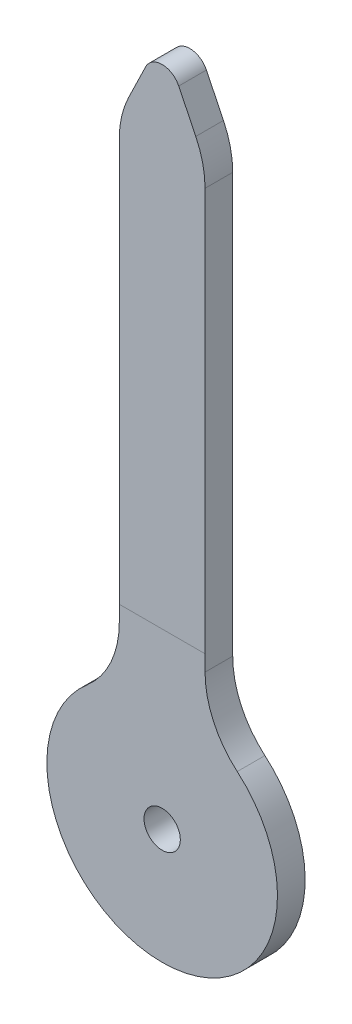
from build123d import *

# Parameters (mm, degrees)
SKETCH1_R           = 0.5
BOSS_EXTRUDE1_DEPTH = 0.762
FILLET1_R           = 2.54
FILLET2_R           = 0.507185


with BuildPart() as part:
    # Sketch1 → Boss-Extrude1 (new body)
    with BuildSketch(Plane.XY):
        with BuildLine():
            Line((-0.3175, 18.2372), (0.3175, 18.2372))
            Line((0.3175, 18.2372), (1.1811, 16.4592))
            Line((1.1811, 16.4592), (1.1811, 2.947138916))
            ThreePointArc((1.1811, 2.947138916), (0, -3.175), (-1.1811, 2.947138916))
            Line((-1.1811, 2.947138916), (-1.1811, 16.4592))
            Line((-1.1811, 16.4592), (-0.3175, 18.2372))
        make_face()
        Circle(SKETCH1_R, mode=Mode.SUBTRACT)
    extrude(amount=BOSS_EXTRUDE1_DEPTH)

    # Fillet1
    fillet1_edges = [part.edges().sort_by_distance(p)[0] for p in [
        (1.1811, 16.4592, 0.381),
        (1.1811, 2.947138916, 0.381),
        (-1.1811, 2.947138916, 0.381),
        (-1.1811, 16.4592, 0.381),
    ]]
    fillet(fillet1_edges, radius=FILLET1_R)

    # Fillet2
    fillet2_edges = [part.edges().sort_by_distance(p)[0] for p in [
        (-0.3175, 18.2372, 0.381),
        (0.3175, 18.2372, 0.381),
    ]]
    fillet(fillet2_edges, radius=FILLET2_R - 0.0001)  # a hair under: the kernel refuses the full size


solid = part.part
